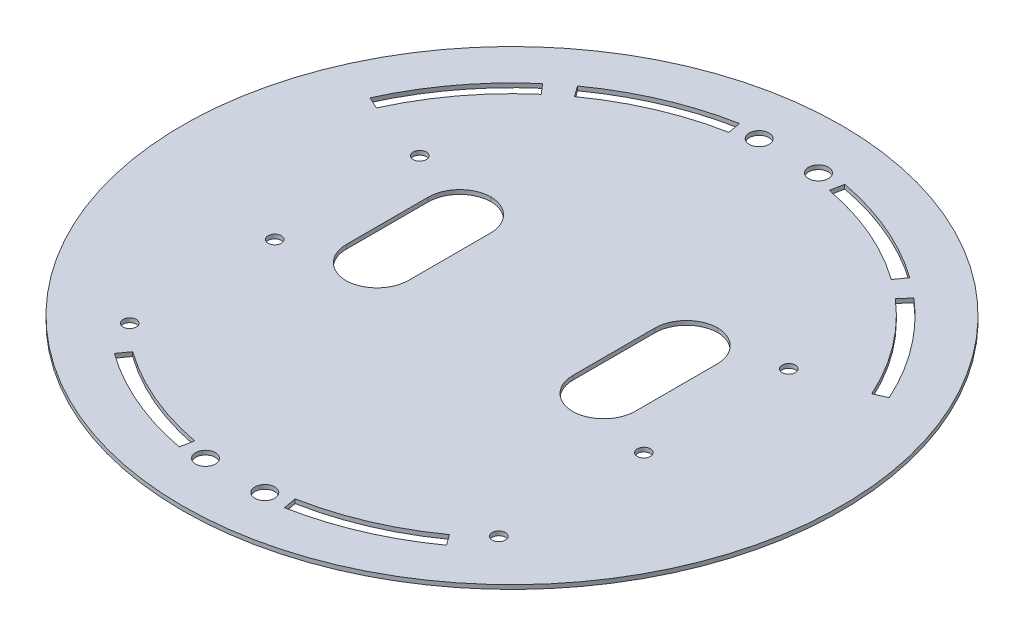
from build123d import *

# Parameters (mm, degrees)
SKETCH1_R           = 1.5875
BOSS_EXTRUDE5_DEPTH = 1.5875
FILLET2_R           = 2.54
FILLET3_R           = 2.54
FILLET4_R           = 5.08
CUT_EXTRUDE1_START  = -2.54
SKETCH2_R           = 2.38125
SKETCH2_R_2         = 1.5875
CUT_EXTRUDE1_DEPTH  = 2.54
SKETCH3_R           = 1.5875
CUT_EXTRUDE2_DEPTH  = 2.54
CUT_EXTRUDE3_DEPTH  = 2.54
SKETCH5_W           = 15
SKETCH5_H           = 34.925
CUT_EXTRUDE4_DEPTH  = 109.650407999
FILLET5_R           = 7.62
FILLET6_R           = 7.62
BOSS_EXTRUDE6_START = -1.5875
BOSS_EXTRUDE6_DEPTH = 1.5875
SKETCH7_R           = 79.375
CUT_EXTRUDE5_DEPTH  = 0.5875


with BuildPart() as part:
    # Sketch1 → Boss-Extrude5 (new body)
    with BuildSketch(Plane(origin=(0, 0, 0), x_dir=(1, 0, 0), z_dir=(0, 1, 0))):
        with BuildLine():
            ThreePointArc((-63.5, -47.625), (-35.497579143, -70.995158286), (0, -79.375))
            ThreePointArc((0, -79.375), (35.497579143, -70.995158286), (63.5, -47.625))
            Line((63.5, -47.625), (50.8, -47.625))
            Line((50.8, -47.625), (50.8, 22.225))
            Line((50.8, 22.225), (76.2, 22.225))
            ThreePointArc((76.2, 22.225), (0, 79.375), (-76.2, 22.225))
            Line((-76.2, 22.225), (-50.8, 22.225))
            Line((-50.8, 22.225), (-50.8, -47.625))
            Line((-50.8, -47.625), (-63.5, -47.625))
        make_face()
        with Locations(Location((-7.14375, -66.675, 0), (0, 0, 270))):
            Circle(SKETCH1_R, mode=Mode.SUBTRACT)
        with BuildLine():
            ThreePointArc((8.73125, -66.675), (7.14375, -68.2625), (5.55625, -66.675))
            ThreePointArc((5.55625, -66.675), (7.14375, -65.0875), (8.73125, -66.675))
        make_face(mode=Mode.SUBTRACT)
        with Locations(Location((-7.14375, 66.675, 0), (0, 0, 270))):
            Circle(SKETCH1_R, mode=Mode.SUBTRACT)
        with Locations(Location((7.14375, 66.675, 0), (0, 0, 270))):
            Circle(SKETCH1_R, mode=Mode.SUBTRACT)
    extrude(amount=BOSS_EXTRUDE5_DEPTH)

    # Fillet2
    fillet2_edges = [part.edges().sort_by_distance(p)[0] for p in [
        (-63.5, 0.79375, 47.625),
    ]]
    fillet(fillet2_edges, radius=FILLET2_R)

    # Fillet3
    fillet3_edges = [part.edges().sort_by_distance(p)[0] for p in [
        (63.5, 0.79375, 47.625),
    ]]
    fillet(fillet3_edges, radius=FILLET3_R)

    # Fillet4
    fillet4_edges = [part.edges().sort_by_distance(p)[0] for p in [
        (-76.2, 0.79375, -22.225),
        (76.2, 0.79375, -22.225),
    ]]
    fillet(fillet4_edges, radius=FILLET4_R)

    # Sketch2 → Cut-Extrude1 (cut)
    # profile 1 of 10: a face of its own
    with BuildSketch(Plane(origin=(0, 1.5875, 0), x_dir=(1, 0, 0), z_dir=(0, 1, 0)).offset(CUT_EXTRUDE1_START)):
        with BuildLine():
            Line((-61.088622125, 27.654457796), (-59.642408406, 26.999765402))
            ThreePointArc((-59.642408406, 26.999765402), (-52.384826382, 39.268743005), (-42.643785254, 49.676068599))
            Line((-42.643785254, 49.676068599), (-43.677815048, 50.880617741))
            Line((-43.677815048, 50.880617741), (-44.711844841, 52.085166883))
            ThreePointArc((-44.711844841, 52.085166883), (-54.925289002, 41.173126022), (-62.534835843, 28.309150189))
            Line((-62.534835843, 28.309150189), (-61.088622125, 27.654457796))
        make_face()
    # profile 2 of 10: a face of its own
    with BuildSketch(Plane(origin=(0, 1.5875, 0), x_dir=(1, 0, 0), z_dir=(0, 1, 0)).offset(CUT_EXTRUDE1_START)):
        with BuildLine():
            Line((-39.077069744, 54.493774041), (-38.151958122, 53.203686937))
            ThreePointArc((-38.151958122, 53.203686937), (-25.732218917, 60.200142208), (-12.092567045, 64.342629994))
            Line((-12.092567045, 64.342629994), (-12.385788543, 65.902815048))
            Line((-12.385788543, 65.902815048), (-12.679010041, 67.463000102))
            ThreePointArc((-12.679010041, 67.463000102), (-26.980132574, 63.119617589), (-40.002181367, 55.783861145))
            Line((-40.002181367, 55.783861145), (-39.077069744, 54.493774041))
        make_face()
    # profile 3 of 10: a face of its own
    with BuildSketch(Plane(origin=(0, 1.5875, 0), x_dir=(1, 0, 0), z_dir=(0, 1, 0)).offset(CUT_EXTRUDE1_START)):
        with Locations(Location((-7.14375, 66.675, 0), (0, 0, 270))):
            Circle(SKETCH2_R)
        with Locations((-7.14375, 66.675)):
            Circle(SKETCH2_R_2, mode=Mode.SUBTRACT)
    # profile 4 of 10: a face of its own
    with BuildSketch(Plane(origin=(0, 1.5875, 0), x_dir=(1, 0, 0), z_dir=(0, 1, 0)).offset(CUT_EXTRUDE1_START)):
        with Locations(Location((7.14375, 66.675, 0), (0, 0, 270))):
            Circle(SKETCH2_R)
        with Locations((7.14375, 66.675)):
            Circle(SKETCH2_R_2, mode=Mode.SUBTRACT)
    # profile 5 of 10: a face of its own
    with BuildSketch(Plane(origin=(0, 1.5875, 0), x_dir=(1, 0, 0), z_dir=(0, 1, 0)).offset(CUT_EXTRUDE1_START)):
        with BuildLine():
            ThreePointArc((12.679010041, 67.463000102), (26.980132574, 63.119617589), (40.002181367, 55.783861145))
            Line((40.002181367, 55.783861145), (39.077069744, 54.493774041))
            Line((39.077069744, 54.493774041), (38.151958122, 53.203686937))
            ThreePointArc((38.151958122, 53.203686937), (25.732218917, 60.200142208), (12.092567045, 64.342629994))
            Line((12.092567045, 64.342629994), (12.385788543, 65.902815048))
            Line((12.385788543, 65.902815048), (12.679010041, 67.463000102))
        make_face()
    # profile 6 of 10: a face of its own
    with BuildSketch(Plane(origin=(0, 1.5875, 0), x_dir=(1, 0, 0), z_dir=(0, 1, 0)).offset(CUT_EXTRUDE1_START)):
        with BuildLine():
            ThreePointArc((44.711844841, 52.085166883), (54.925289002, 41.173126022), (62.534835843, 28.309150189))
            Line((62.534835843, 28.309150189), (59.642408406, 26.999765402))
            ThreePointArc((59.642408406, 26.999765402), (52.384826382, 39.268743005), (42.643785254, 49.676068599))
            Line((42.643785254, 49.676068599), (43.677815048, 50.880617741))
            Line((43.677815048, 50.880617741), (44.711844841, 52.085166883))
        make_face()
    # profile 7 of 10: a face of its own
    with BuildSketch(Plane(origin=(0, 1.5875, 0), x_dir=(1, 0, 0), z_dir=(0, 1, 0)).offset(CUT_EXTRUDE1_START)):
        with BuildLine():
            ThreePointArc((-12.679010041, -67.463000102), (-26.980132574, -63.119617589), (-40.002181367, -55.783861145))
            Line((-40.002181367, -55.783861145), (-39.077069744, -54.493774041))
            Line((-39.077069744, -54.493774041), (-38.151958122, -53.203686937))
            ThreePointArc((-38.151958122, -53.203686937), (-25.732218917, -60.200142208), (-12.092567045, -64.342629994))
            Line((-12.092567045, -64.342629994), (-12.385788543, -65.902815048))
            Line((-12.385788543, -65.902815048), (-12.679010041, -67.463000102))
        make_face()
    # profile 8 of 10: a face of its own
    with BuildSketch(Plane(origin=(0, 1.5875, 0), x_dir=(1, 0, 0), z_dir=(0, 1, 0)).offset(CUT_EXTRUDE1_START)):
        with Locations(Location((-7.14375, -66.675, 0), (0, 0, 270))):
            Circle(SKETCH2_R)
        with Locations((-7.14375, -66.675)):
            Circle(SKETCH2_R_2, mode=Mode.SUBTRACT)
    # profile 9 of 10: a face of its own
    with BuildSketch(Plane(origin=(0, 1.5875, 0), x_dir=(1, 0, 0), z_dir=(0, 1, 0)).offset(CUT_EXTRUDE1_START)):
        with Locations(Location((7.14375, -66.675, 0), (0, 0, 270))):
            Circle(SKETCH2_R)
        with Locations((7.14375, -66.675)):
            Circle(SKETCH2_R_2, mode=Mode.SUBTRACT)
    # profile 10 of 10: a face of its own
    with BuildSketch(Plane(origin=(0, 1.5875, 0), x_dir=(1, 0, 0), z_dir=(0, 1, 0)).offset(CUT_EXTRUDE1_START)):
        with BuildLine():
            ThreePointArc((12.092567045, -64.342629994), (25.732218917, -60.200142208), (38.151958122, -53.203686937))
            Line((38.151958122, -53.203686937), (39.077069744, -54.493774041))
            Line((39.077069744, -54.493774041), (40.002181367, -55.783861145))
            ThreePointArc((40.002181367, -55.783861145), (26.980132574, -63.119617589), (12.679010041, -67.463000102))
            Line((12.679010041, -67.463000102), (12.385788543, -65.902815048))
            Line((12.385788543, -65.902815048), (12.092567045, -64.342629994))
        make_face()
    extrude(amount=CUT_EXTRUDE1_DEPTH, mode=Mode.SUBTRACT)

    # Sketch3 → Cut-Extrude2 (cut)
    with BuildSketch(Plane(origin=(0, 1.5875, 0), x_dir=(1, 0, 0), z_dir=(0, 1, 0))):
        with Locations(Location((-44.45, -47.625, 0), (0, 0, 270))):
            Circle(SKETCH3_R)
        with Locations(Location((-44.45, 22.225, 0), (0, 0, 270))):
            Circle(SKETCH3_R)
        with Locations(Location((44.45, 22.225, 0), (0, 0, 270))):
            Circle(SKETCH3_R)
        with Locations(Location((44.45, -47.625, 0), (0, 0, 270))):
            Circle(SKETCH3_R)
    extrude(amount=-CUT_EXTRUDE2_DEPTH, mode=Mode.SUBTRACT)

    # Sketch4 → Cut-Extrude3 (cut)
    with BuildSketch(Plane(origin=(0, 1.5875, 0), x_dir=(1, 0, 0), z_dir=(0, 1, 0))):
        with BuildLine():
            ThreePointArc((-44.45, -11.1125), (-46.0375, -12.7), (-44.45, -14.2875))
            Line((-44.45, -14.2875), (-44.45, -11.1125))
        make_face()
        with BuildLine():
            Line((-44.45, -11.1125), (-44.45, -14.2875))
            ThreePointArc((-44.45, -14.2875), (-43.327467985, -13.822532015), (-42.8625, -12.7))
            ThreePointArc((-42.8625, -12.7), (-43.327467985, -11.577467985), (-44.45, -11.1125))
        make_face()
        with BuildLine():
            ThreePointArc((44.45, -11.1125), (42.8625, -12.7), (44.45, -14.2875))
            Line((44.45, -14.2875), (44.45, -11.1125))
        make_face()
        with BuildLine():
            Line((44.45, -11.1125), (44.45, -14.2875))
            ThreePointArc((44.45, -14.2875), (45.572532015, -13.822532015), (46.0375, -12.7))
            ThreePointArc((46.0375, -12.7), (45.572532015, -11.577467985), (44.45, -11.1125))
        make_face()
    extrude(amount=-CUT_EXTRUDE3_DEPTH, mode=Mode.SUBTRACT)

    # Sketch5 → Cut-Extrude4 (cut, through all)
    with BuildSketch(Plane(origin=(0, 1.5875, 0), x_dir=(1, 0, 0), z_dir=(0, 1, 0))):
        with Locations((-27.3, 4.7625)):
            Rectangle(SKETCH5_W, SKETCH5_H)
        with Locations((27.3, 4.7625)):
            Rectangle(SKETCH5_W, SKETCH5_H)
    extrude(amount=-CUT_EXTRUDE4_DEPTH, mode=Mode.SUBTRACT)

    # Fillet5
    # the kernel refuses this fillet: 7.62 mm, written as the material it adds along each edge
    with BuildSketch(Plane(origin=(-19.8, 1.5875, 12.7), x_dir=(0, 0, -1), z_dir=(0, -1, 0))) as fillet5_piece_1:
        with BuildLine():
            CenterArc((FILLET5_R, -FILLET5_R), FILLET5_R, 90, 90)
            Line((0, -FILLET5_R), (0, 0))
            Line((0, 0), (FILLET5_R, 0))
        make_face()
    extrude(amount=1.5875)
    with BuildSketch(Plane(origin=(-34.8, 1.5875, 12.7), x_dir=(0, 0, -1), z_dir=(0, -1, 0)), Plane(origin=(-19.8, 1.5875, -22.225), x_dir=(0, 0, 1), z_dir=(0, -1, 0)), Plane(origin=(-34.8, 1.5875, -22.225), x_dir=(1, 0, 0), z_dir=(0, -1, 0))) as fillet5_piece_2:
        with BuildLine():
            CenterArc((FILLET5_R, FILLET5_R), FILLET5_R, 180, 90)
            Line((0, FILLET5_R), (0, 0))
            Line((0, 0), (FILLET5_R, 0))
        make_face()
    extrude(amount=1.5875)

    # Fillet6
    # the kernel refuses this fillet: 7.62 mm, written as the material it adds along each edge
    with BuildSketch(Plane(origin=(34.8, 1.5875, 12.7), x_dir=(0, 0, -1), z_dir=(0, -1, 0)), Plane(origin=(34.8, 1.5875, -22.225), x_dir=(-1, 0, 0), z_dir=(0, -1, 0))) as fillet6_piece_1:
        with BuildLine():
            CenterArc((FILLET6_R, -FILLET6_R), FILLET6_R, 90, 90)
            Line((0, -FILLET6_R), (0, 0))
            Line((0, 0), (FILLET6_R, 0))
        make_face()
    extrude(amount=1.5875)
    with BuildSketch(Plane(origin=(19.8, 1.5875, -22.225), x_dir=(1, 0, 0), z_dir=(0, -1, 0)), Plane(origin=(19.8, 1.5875, 12.7), x_dir=(0, 0, -1), z_dir=(0, -1, 0))) as fillet6_piece_2:
        with BuildLine():
            CenterArc((FILLET6_R, FILLET6_R), FILLET6_R, 180, 90)
            Line((0, FILLET6_R), (0, 0))
            Line((0, 0), (FILLET6_R, 0))
        make_face()
    extrude(amount=1.5875)

    # Sketch6 → Boss-Extrude6 (add)
    with BuildSketch(Plane(origin=(0, 1.5875, 0), x_dir=(1, 0, 0), z_dir=(0, 1, 0)).offset(BOSS_EXTRUDE6_START)):
        with BuildLine():
            Line((-50.8, -60.989758362), (-50.8, 22.225))
            Line((-50.8, 22.225), (-69.095470184, 22.225))
            Line((-69.095470184, 22.225), (-69.095470184, 39.066694575))
            ThreePointArc((-69.095470184, 39.066694575), (-78.080435361, -14.277122916), (-50.8, -60.989758362))
        make_face()
        with BuildLine():
            Line((50.8, 22.225), (50.8, -60.989758362))
            ThreePointArc((50.8, -60.989758362), (71.877119534, -33.675960454), (79.375, 0))
            ThreePointArc((79.375, 0), (76.762111653, 20.198238526), (69.095470184, 39.066694575))
            Line((69.095470184, 39.066694575), (69.095470184, 22.225))
            Line((69.095470184, 22.225), (50.8, 22.225))
        make_face()
    extrude(amount=BOSS_EXTRUDE6_DEPTH)

    # Sketch7 → Cut-Extrude5 (cut)
    with BuildSketch(Plane.XZ):
        with Locations(Location((0, 0, 0), (0, 0, 270))):
            Circle(SKETCH7_R)
    extrude(amount=-CUT_EXTRUDE5_DEPTH, mode=Mode.SUBTRACT)


solid = part.part
